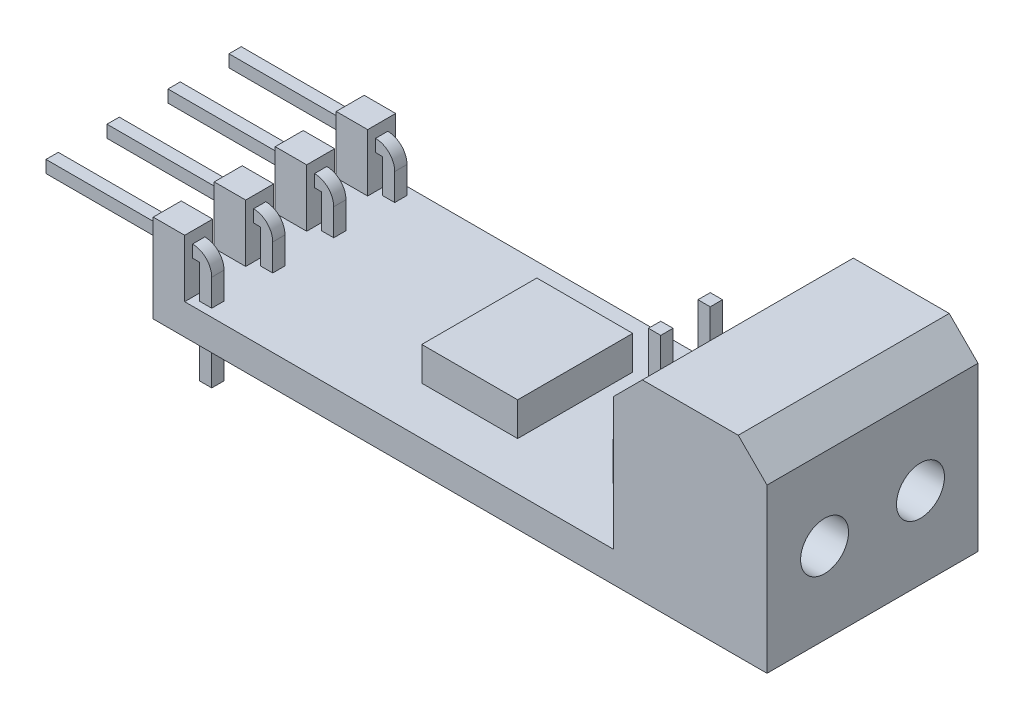
from build123d import *

# Parameters (mm, degrees)
SKETCH_1_W           = 32
SKETCH_1_H           = 11
EXTRUDE_1_DEPTH      = 1.6
SKETCH_2_W           = 0.64
SKETCH_2_H           = 0.64
EXTRUDE_2_DEPTH      = 6
SKETCH_3_W           = 0.64
SKETCH_3_H           = 0.64
EXTRUDE_3_DEPTH      = 8
FILLET_2_R           = 1
FILLET_3_R           = 1
FILLET_4_R           = 1
FILLET_5_R           = 1
SKETCH_4_W           = 8
SKETCH_4_H           = 11
EXTRUDE_4_DEPTH      = 8.4
FILLET_START         = 9
FILLET_4_2_OUTLINE_W = 6
FILLET_4_2_OUTLINE_H = 13
FILLET_4_2_DEPTH     = 1.960155108
FILLET_START_2       = 28.637824638
FILLET_5_2_OUTLINE_W = 5
FILLET_5_2_OUTLINE_H = 13
FILLET_5_2_DEPTH     = 2.362175362
SKETCH_5_R           = 1.25
CUT_EXTRUDE_1_DEPTH  = 6
SKETCH_6_W           = 2.5
SKETCH_6_H           = 2.5
EXTRUDE_5_DEPTH      = 2
SKETCH_7_W           = 0.64
SKETCH_7_H           = 0.64
EXTRUDE_6_DEPTH      = 5
SKETCH_8_W           = 5
SKETCH_8_H           = 6
EXTRUDE_7_DEPTH      = 1.75
SKETCH_9_W           = 1.64
SKETCH_9_H           = 1.46
EXTRUDE_8_DEPTH      = 3


with BuildPart() as part:
    # Эскиз1 → Бобышка-Вытянуть1 (new body)
    with BuildSketch(Plane(origin=(0, 0, 0), x_dir=(1, 0, 0), z_dir=(0, 1, 0))):
        with Locations((16, -5.5)):
            Rectangle(SKETCH_1_W, SKETCH_1_H)
    extrude(amount=EXTRUDE_1_DEPTH)

    # Эскиз2 → Бобышка-Вытянуть2 (add)
    with BuildSketch(Plane(origin=(0, -2, 0), x_dir=(-1, 0, 0), z_dir=(0, -1, 0))):
        with Locations((-2.32, -0.73)):
            Rectangle(SKETCH_2_W, SKETCH_2_H)
        with Locations((-2.32, -3.91)):
            Rectangle(SKETCH_2_W, SKETCH_2_H)
        with Locations((-2.32, -7.09)):
            Rectangle(SKETCH_2_W, SKETCH_2_H)
        with Locations((-2.32, -10.27)):
            Rectangle(SKETCH_2_W, SKETCH_2_H)
    extrude(amount=-EXTRUDE_2_DEPTH)

    # Эскиз3 → Бобышка-Вытянуть3 (add)
    with BuildSketch(Plane.ZY.offset(-2)):
        with Locations((0.73, 3.68)):
            Rectangle(SKETCH_3_W, SKETCH_3_H)
        with Locations((3.91, 3.68)):
            Rectangle(SKETCH_3_W, SKETCH_3_H)
        with Locations((7.09, 3.68)):
            Rectangle(SKETCH_3_W, SKETCH_3_H)
        with Locations((10.27, 3.68)):
            Rectangle(SKETCH_3_W, SKETCH_3_H)
    extrude(amount=EXTRUDE_3_DEPTH)

    # Скругление2
    fillet_2_edges = [part.edges().sort_by_distance(p)[0] for p in [
        (2.64, 4, 10.27),
    ]]
    fillet(fillet_2_edges, radius=FILLET_2_R)

    # Скругление3
    fillet_3_edges = [part.edges().sort_by_distance(p)[0] for p in [
        (2.64, 4, 0.73),
    ]]
    fillet(fillet_3_edges, radius=FILLET_3_R)

    # Fillet 4
    fillet_4_edges = [part.edges().sort_by_distance(p)[0] for p in [
        (2.64, 4, 3.91),
    ]]
    fillet(fillet_4_edges, radius=FILLET_4_R)

    # Fillet 5
    fillet_5_edges = [part.edges().sort_by_distance(p)[0] for p in [
        (2.64, 4, 7.09),
    ]]
    fillet(fillet_5_edges, radius=FILLET_5_R)

    # Эскиз4 → Бобышка-Вытянуть4 (add)
    with BuildSketch(Plane(origin=(0, 1.6, 0), x_dir=(1, 0, 0), z_dir=(0, 1, 0))):
        with Locations((28, -5.5)):
            Rectangle(SKETCH_4_W, SKETCH_4_H)
    extrude(amount=EXTRUDE_4_DEPTH)

    # Fillet 4 2: read off the stored shape, not the designer's step
    # Fillet 4 2 outline → Fillet 4 2 (cut)
    with BuildSketch(Plane(origin=(0, 0, 0), x_dir=(0.707106781186548, 0.707106781186547, 0), z_dir=(0.707106781186547, -0.707106781186548, 0)).offset(FILLET_START)):
        with Locations((24, 5.5)):
            Rectangle(FILLET_4_2_OUTLINE_W, FILLET_4_2_OUTLINE_H)
    extrude(amount=FILLET_4_2_DEPTH, mode=Mode.SUBTRACT)

    # Fillet 5 2: read off the stored shape, not the designer's step
    # Fillet 5 2 outline → Fillet 5 2 (cut)
    with BuildSketch(Plane(origin=(0, 0, 0), x_dir=(0.707106781186548, -0.707106781186547, 0), z_dir=(0.707106781186547, 0.707106781186548, 0)).offset(FILLET_START_2)):
        with Locations((15.5, -5.5)):
            Rectangle(FILLET_5_2_OUTLINE_W, FILLET_5_2_OUTLINE_H)
    extrude(amount=FILLET_5_2_DEPTH, mode=Mode.SUBTRACT)

    # Эскиз5 → Вырез-Вытянуть1 (cut)
    with BuildSketch(Plane(origin=(32, 0, 0), x_dir=(0, 0, -1), z_dir=(1, 0, 0))):
        with Locations((-8, 4.25)):
            Circle(SKETCH_5_R)
        with Locations((-3, 4.25)):
            Circle(SKETCH_5_R)
    extrude(amount=-CUT_EXTRUDE_1_DEPTH, mode=Mode.SUBTRACT)

    # Эскиз6 → Бобышка-Вытянуть5 (add)
    with BuildSketch(Plane(origin=(0, 1.6, 0), x_dir=(1, 0, 0), z_dir=(0, 1, 0))):
        with Locations((22.25, -4.21)):
            Rectangle(SKETCH_6_W, SKETCH_6_H)
        with Locations((22.25, -6.79)):
            Rectangle(SKETCH_6_W, SKETCH_6_H)
    extrude(amount=EXTRUDE_5_DEPTH)

    # Эскиз7 → Бобышка-Вытянуть6 (add)
    with BuildSketch(Plane(origin=(0, 3.6, 0), x_dir=(1, 0, 0), z_dir=(0, 1, 0))):
        with Locations((22.25, -4.21)):
            Rectangle(SKETCH_7_W, SKETCH_7_H)
        with Locations((22.25, -6.79)):
            Rectangle(SKETCH_7_W, SKETCH_7_H)
    extrude(amount=EXTRUDE_6_DEPTH)

    # Эскиз8 → Бобышка-Вытянуть7 (add)
    with BuildSketch(Plane(origin=(0, 1.6, 0), x_dir=(1, 0, 0), z_dir=(0, 1, 0))):
        with Locations((14, -5.5)):
            Rectangle(SKETCH_8_W, SKETCH_8_H)
    extrude(amount=EXTRUDE_7_DEPTH)

    # Эскиз9 → Бобышка-Вытянуть8 (add)
    with BuildSketch(Plane(origin=(0, 1.6, 0), x_dir=(1, 0, 0), z_dir=(0, 1, 0))):
        with Locations((0.82, -0.73)):
            Rectangle(SKETCH_9_W, SKETCH_9_H)
        with Locations((0.82, -3.91)):
            Rectangle(SKETCH_9_W, SKETCH_9_H)
        with Locations((0.82, -7.09)):
            Rectangle(SKETCH_9_W, SKETCH_9_H)
        with Locations((0.82, -10.27)):
            Rectangle(SKETCH_9_W, SKETCH_9_H)
    extrude(amount=EXTRUDE_8_DEPTH)


solid = part.part
